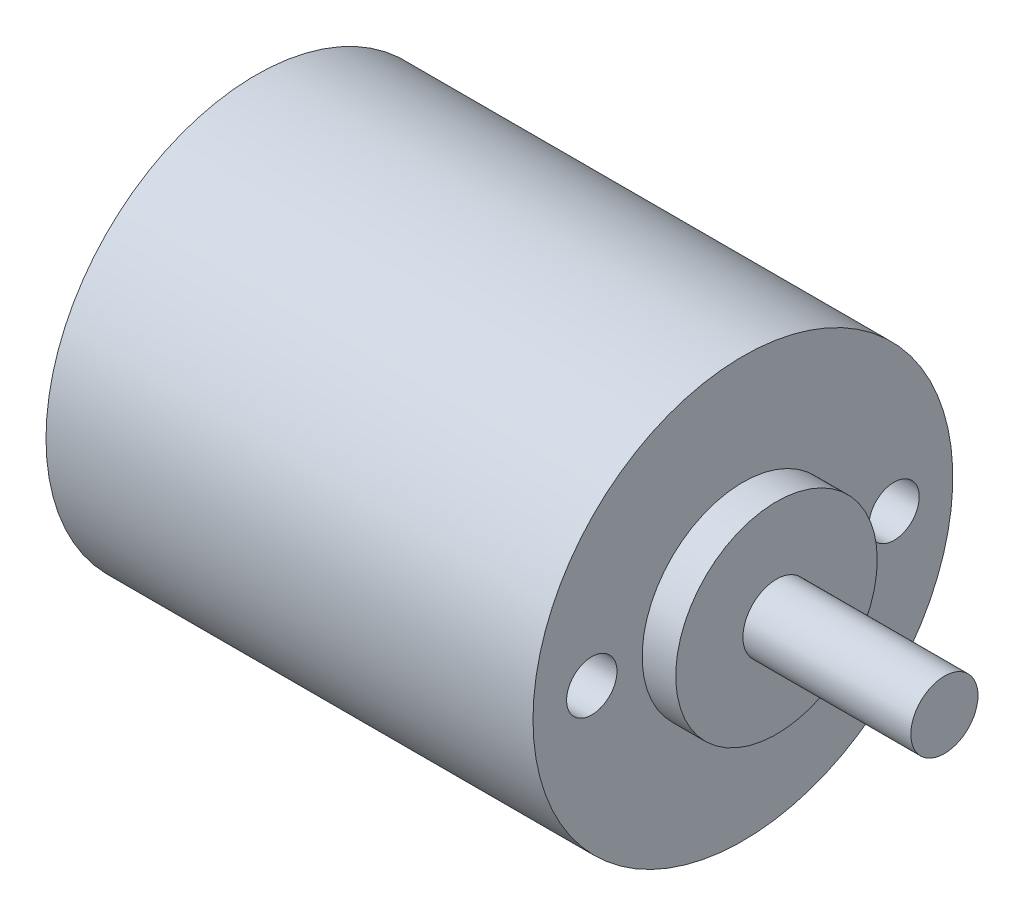
from build123d import *

# Parameters (mm, degrees)
SKETCH_1_R          = 12.5
EXTRUDE_3_DEPTH     = 29
SKETCH_4_R          = 6
EXTRUDE_4_DEPTH     = 2
SKETCH_5_R          = 2
EXTRUDE_5_DEPTH     = 10
SKETCH_6_R          = 1.5
CUT_EXTRUDE_1_DEPTH = 19
SKETCH_7_R          = 3.25
EXTRUDE_6_DEPTH     = 5.5


with BuildPart() as part:
    # 草图1 → 凸台-拉伸3 (new body)
    with BuildSketch(Plane(origin=(0, 0, 0), x_dir=(0, 0, -1), z_dir=(1, 0, 0))):
        Circle(SKETCH_1_R)
    extrude(amount=EXTRUDE_3_DEPTH)

    # 草图4 → 凸台-拉伸4 (add)
    with BuildSketch(Plane(origin=(29, 0, 0), x_dir=(0, 0, -1), z_dir=(1, 0, 0))):
        Circle(SKETCH_4_R)
    extrude(amount=EXTRUDE_4_DEPTH)

    # 草图5 → 凸台-拉伸5 (add)
    with BuildSketch(Plane(origin=(31, 0, 0), x_dir=(0, 0, -1), z_dir=(1, 0, 0))):
        Circle(SKETCH_5_R)
    extrude(amount=EXTRUDE_5_DEPTH)

    # 草图6 → 切除-拉伸1 (cut)
    with BuildSketch(Plane(origin=(41, 0, 0), x_dir=(0, 0, -1), z_dir=(1, 0, 0))):
        with Locations((-9, 0)):
            Circle(SKETCH_6_R)
        with Locations((9, 0)):
            Circle(SKETCH_6_R)
    extrude(amount=-CUT_EXTRUDE_1_DEPTH, mode=Mode.SUBTRACT)

    # 草图7 → 凸台-拉伸6 (add)
    with BuildSketch(Plane.ZY):
        with Locations((0, -6)):
            Circle(SKETCH_7_R)
    extrude(amount=EXTRUDE_6_DEPTH)


solid = part.part
